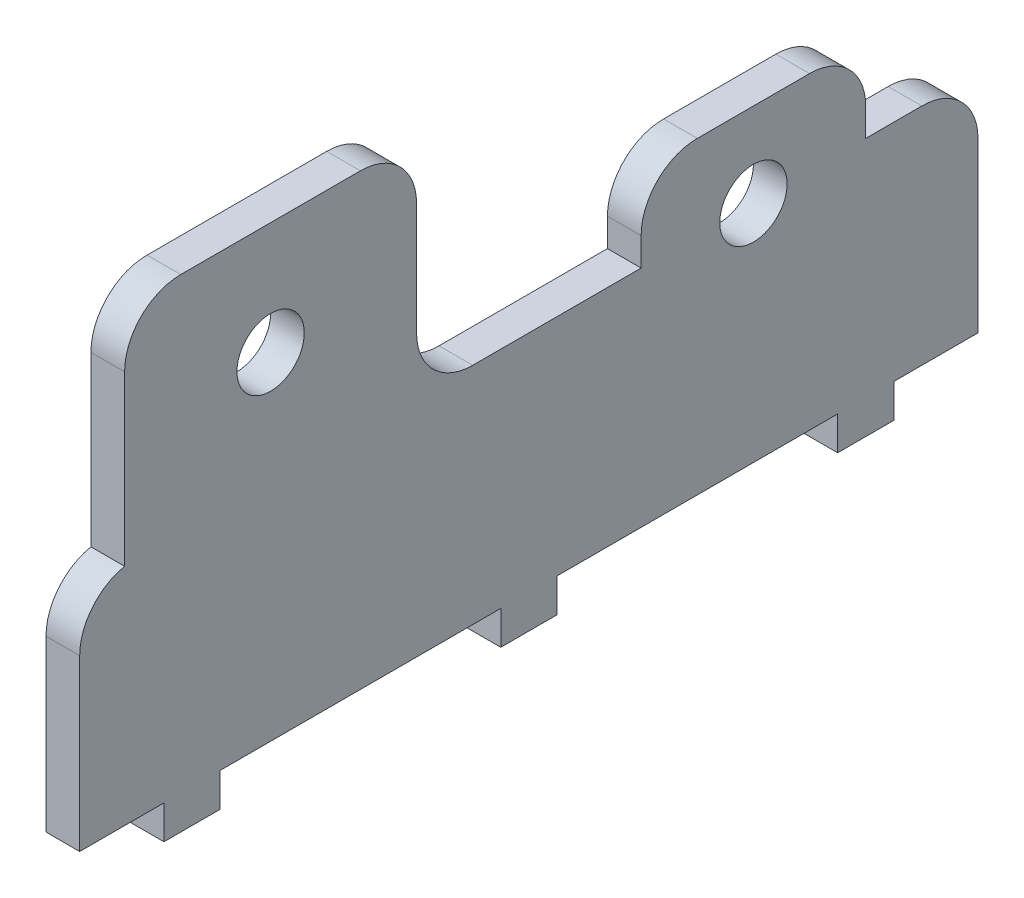
from build123d import *

# Parameters (mm, degrees)
SKETCH1_W           = 80
SKETCH1_H           = 40
BOSS_EXTRUDE1_DEPTH = 3
SKETCH2_R           = 3
SKETCH2_W           = 4
SKETCH2_H           = 20
CUT_EXTRUDE1_DEPTH  = 65.101482042
FILLET2_R           = 5
SKETCH3_W           = 3
SKETCH3_H           = 5
BOSS_EXTRUDE2_DEPTH = 3
LPATTERN1_COUNT     = 3
LPATTERN1_PITCH     = 30


with BuildPart() as part:
    # Sketch1 → Boss-Extrude1 (new body)
    with BuildSketch(Plane(origin=(0, 0, 0), x_dir=(0, 0, -1), z_dir=(1, 0, 0))):
        with Locations((10, 20)):
            Rectangle(SKETCH1_W, SKETCH1_H)
    extrude(amount=BOSS_EXTRUDE1_DEPTH)

    # Sketch2 → Cut-Extrude1 (cut, through all)
    with BuildSketch(Plane(origin=(3, 0, 0), x_dir=(0, 0, -1), z_dir=(1, 0, 0))):
        with Locations((30, 20)):
            Circle(SKETCH2_R)
        with Locations((-13, 30)):
            Circle(SKETCH2_R)
        Polygon((0, 40), (50, 40), (50, 27.5), (50, 20), (40, 20), (40, 27.5), (20, 27.5), (20, 20), (0, 20), (0, 27.5), align=None)
        with Locations((-28, 30)):
            Rectangle(SKETCH2_W, SKETCH2_H)
    extrude(amount=-CUT_EXTRUDE1_DEPTH, mode=Mode.SUBTRACT)

    # Fillet2
    # the kernel refuses this fillet: 5 mm, written as the material it adds along each edge
    with BuildSketch(Plane(origin=(3, 20, 0), x_dir=(0, 0, -1), z_dir=(-1, 0, 0))) as fillet2_piece_1:
        with BuildLine():
            CenterArc((FILLET2_R, -FILLET2_R), FILLET2_R, 90, 90)
            Line((0, -FILLET2_R), (0, 0))
            Line((0, 0), (FILLET2_R, 0))
        make_face()
    extrude(amount=3)
    # the kernel refuses this fillet: 5 mm, written as the material it takes off along each edge
    with BuildSketch(Plane(origin=(15.5, 40, 26), x_dir=(0, 0, -1), z_dir=(-1, 0, 0)), Plane(origin=(15.5, 27.5, -40), x_dir=(0, -1, 0), z_dir=(-1, 0, 0)), Plane(origin=(15.5, 27.5, -20), x_dir=(0, 0, -1), z_dir=(-1, 0, 0)), Plane(origin=(15.5, 40, 0), x_dir=(0, -1, 0), z_dir=(-1, 0, 0)), Plane(origin=(15.5, 20, -50), x_dir=(0, -1, 0), z_dir=(-1, 0, 0))) as fillet2_2_piece_1:
        with BuildLine():
            CenterArc((FILLET2_R, FILLET2_R), FILLET2_R, 180, 90)
            Line((0, FILLET2_R), (0, 0))
            Line((0, 0), (FILLET2_R, 0))
        make_face()
    extrude(amount=28, mode=Mode.SUBTRACT)
    with BuildSketch(Plane(origin=(15.247448714, 20, 30), x_dir=(0, -1, 0), z_dir=(-1, 0, 0))) as fillet2_2_piece_2:
        with BuildLine():
            CenterArc((4.898979486, -5), FILLET2_R, 90, 78.463040967)
            Line((0, -4), (0, 0))
            Line((0, 0), (4.898979486, 0))
        make_face()
    extrude(amount=27.494897428, mode=Mode.SUBTRACT)

    # Sketch3 → Boss-Extrude2 (add)
    with BuildSketch(Plane.XZ):
        with Locations((1.5, -40)):
            Rectangle(SKETCH3_W, SKETCH3_H)
    boss_extrude2 = extrude(amount=BOSS_EXTRUDE2_DEPTH)

    # LPattern1: Boss-Extrude2 ×3
    with Locations(*[(0, 0, i * LPATTERN1_PITCH) for i in range(1, LPATTERN1_COUNT)]):
        add(boss_extrude2)


solid = part.part
